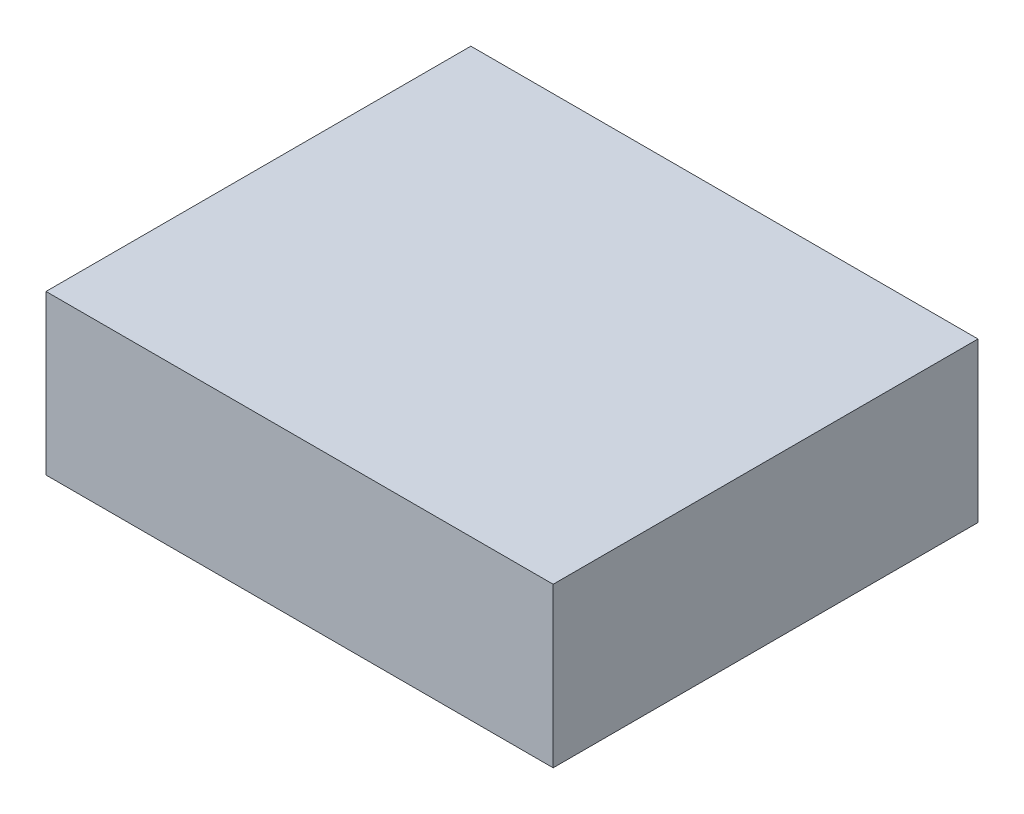
from build123d import *

# Parameters (mm, degrees)
SKETCH1_W           = 25.1968
SKETCH1_H           = 21.1074
BOSS_EXTRUDE1_DEPTH = 7.8994


with BuildPart() as part:
    # Sketch1 → Boss-Extrude1 (new body)
    with BuildSketch(Plane(origin=(0, 0, 0), x_dir=(1, 0, 0), z_dir=(0, 1, 0))):
        Rectangle(SKETCH1_W, SKETCH1_H)
    extrude(amount=BOSS_EXTRUDE1_DEPTH)


solid = part.part
